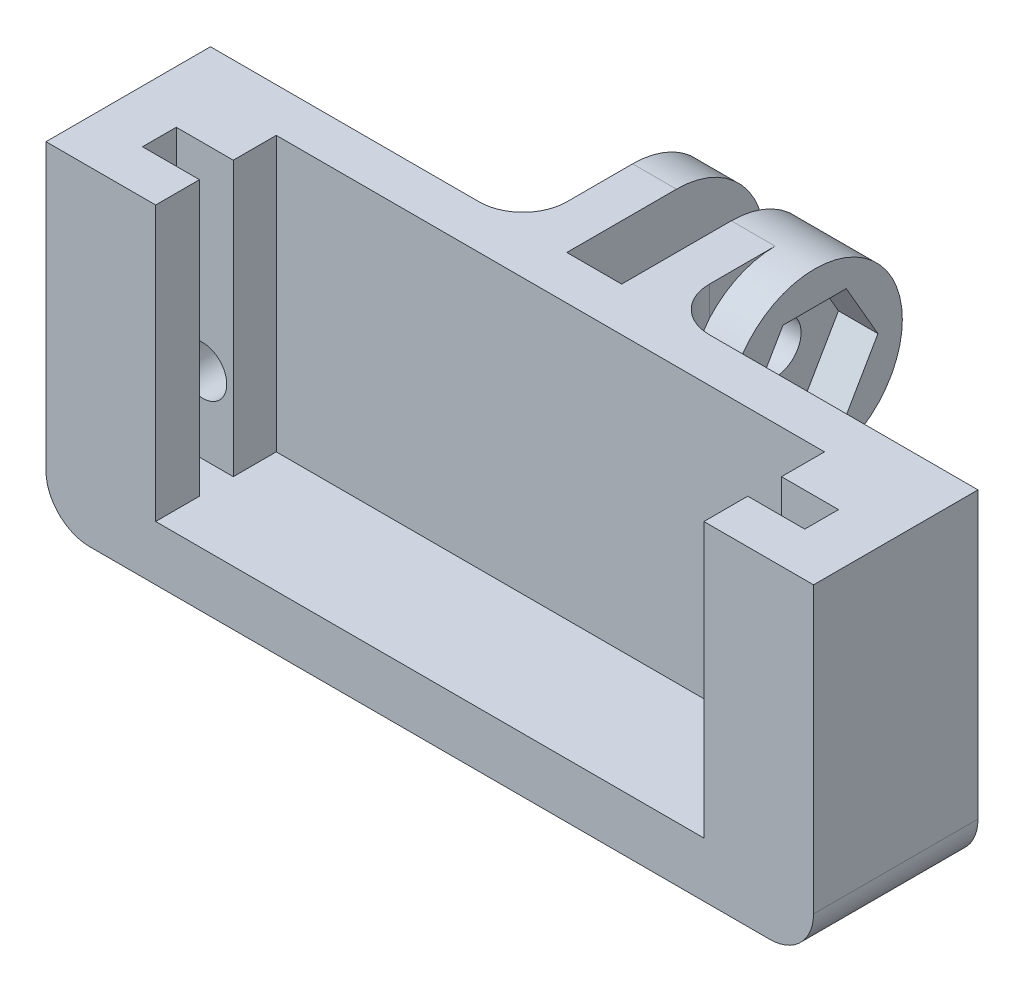
from build123d import *

# Parameters (mm, degrees)
SKETCH1_W           = 44.45
SKETCH1_H           = 19.05
BOSS_EXTRUDE1_DEPTH = 6.985
BOSS_EXTRUDE3_START = 1.5875
SKETCH4_R           = 1.5
BOSS_EXTRUDE3_DEPTH = 2.54
SKETCH5_R           = 5.08
BOSS_EXTRUDE4_DEPTH = 2.286
FILLET3_R           = 2.54
FILLET4_R           = 2.54
SKETCH7_W           = 31.75
SKETCH7_H           = 15.875
CUT_EXTRUDE1_DEPTH  = 4.445
SKETCH8_W           = 38.354
SKETCH8_H           = 15.875
CUT_EXTRUDE2_DEPTH  = 1.9558
BOSS_EXTRUDE5_DEPTH = 2.54
FILLET5_R           = 2.54
SKETCH12_R          = 1.4
CUT_EXTRUDE5_DEPTH  = 6.985


with BuildPart() as part:
    # Sketch1 → Boss-Extrude1 (new body)
    with BuildSketch(Plane.XY):
        Rectangle(SKETCH1_W, SKETCH1_H)
    extrude(amount=BOSS_EXTRUDE1_DEPTH)

    # Sketch4 → Boss-Extrude3 (add)
    with BuildSketch(Plane(origin=(0, 0, 0), x_dir=(0, 0, -1), z_dir=(1, 0, 0)).offset(BOSS_EXTRUDE3_START)):
        with BuildLine():
            Line((0, 9.525), (6.35, 9.525))
            ThreePointArc((6.35, 9.525), (11.43, 4.445), (6.35, -0.635))
            Line((6.35, -0.635), (0, -0.635))
            Line((0, -0.635), (0, 9.525))
        make_face()
        with Locations((6.35, 4.445)):
            Circle(SKETCH4_R, mode=Mode.SUBTRACT)
    boss_extrude3 = extrude(amount=BOSS_EXTRUDE3_DEPTH)

    # Mirror1: Boss-Extrude3 across plane
    add(boss_extrude3.mirror(Plane(origin=(0, 0, 0), x_dir=(0, 0, 1), z_dir=(1, 0, 0))))

    # Sketch5 → Boss-Extrude4 (add)
    with BuildSketch(Plane(origin=(4.1275, 0, 0), x_dir=(0, 0, -1), z_dir=(1, 0, 0))):
        with Locations(Location((6.35, 4.445, 0), (0, 0, 90))):
            Circle(SKETCH5_R)
        Polygon((8.183087105, 7.62), (4.516912895, 7.62), (2.683825791, 4.445), (4.516912895, 1.27), (8.183087105, 1.27), (10.016174209, 4.445), align=None, mode=Mode.SUBTRACT)
    extrude(amount=BOSS_EXTRUDE4_DEPTH)

    # Fillet3
    # the kernel refuses this fillet: 2.54 mm, written as the material it adds along each edge
    with BuildSketch(Plane(origin=(-4.1275, -0.635, 0), x_dir=(-1, 0, 0), z_dir=(0, 1, 0))) as fillet3_piece_1:
        with BuildLine():
            CenterArc((FILLET3_R, -FILLET3_R), FILLET3_R, 90, 90)
            Line((0, -FILLET3_R), (0, 0))
            Line((0, 0), (FILLET3_R, 0))
        make_face()
    extrude(amount=10.16)
    with BuildSketch(Plane(origin=(4.1275, -0.635, 0), x_dir=(1, 0, 0), z_dir=(0, 1, 0))) as fillet3_piece_2:
        with BuildLine():
            CenterArc((FILLET3_R, FILLET3_R), FILLET3_R, 180, 90)
            Line((0, FILLET3_R), (0, 0))
            Line((0, 0), (FILLET3_R, 0))
        make_face()
    extrude(amount=10.16)

    # Fillet4
    fillet4_edges = [part.edges().sort_by_distance(p)[0] for p in [
        (-4.1275, -0.635, 0),
        (4.1275, -0.635, 0),
    ]]
    fillet(fillet4_edges, radius=FILLET4_R)

    # Sketch7 → Cut-Extrude1 (cut)
    with BuildSketch(Plane.XY.offset(6.985)):
        with Locations((0, 1.5875)):
            Rectangle(SKETCH7_W, SKETCH7_H)
    extrude(amount=-CUT_EXTRUDE1_DEPTH, mode=Mode.SUBTRACT)

    # Sketch8 → Cut-Extrude2 (cut)
    with BuildSketch(Plane.XY.offset(6.985)):
        with Locations((0, 1.5875)):
            Rectangle(SKETCH8_W, SKETCH8_H)
    extrude(amount=-CUT_EXTRUDE2_DEPTH, mode=Mode.SUBTRACT)

    # Sketch9 → Boss-Extrude5 (add)
    with BuildSketch(Plane.XY.offset(6.985)):
        Polygon((-22.225, 9.525), (-15.875, 9.525), (-15.875, -6.35), (15.875, -6.35), (15.875, 9.525), (22.225, 9.525), (22.225, -9.525), (-22.225, -9.525), align=None)
    extrude(amount=BOSS_EXTRUDE5_DEPTH)

    # Fillet5
    fillet5_edges = [part.edges().sort_by_distance(p)[0] for p in [
        (22.225, -9.525, 4.7625),
        (-22.225, -9.525, 4.7625),
    ]]
    fillet(fillet5_edges, radius=FILLET5_R)

    # Sketch12 → Cut-Extrude5 (cut)
    with BuildSketch(Plane(origin=(0, 0, 0), x_dir=(-1, 0, 0), z_dir=(0, 0, -1))):
        with Locations((-17.653, -1.905)):
            Circle(SKETCH12_R)
        with Locations((17.653, -1.905)):
            Circle(SKETCH12_R)
    extrude(amount=-CUT_EXTRUDE5_DEPTH, mode=Mode.SUBTRACT)


solid = part.part
